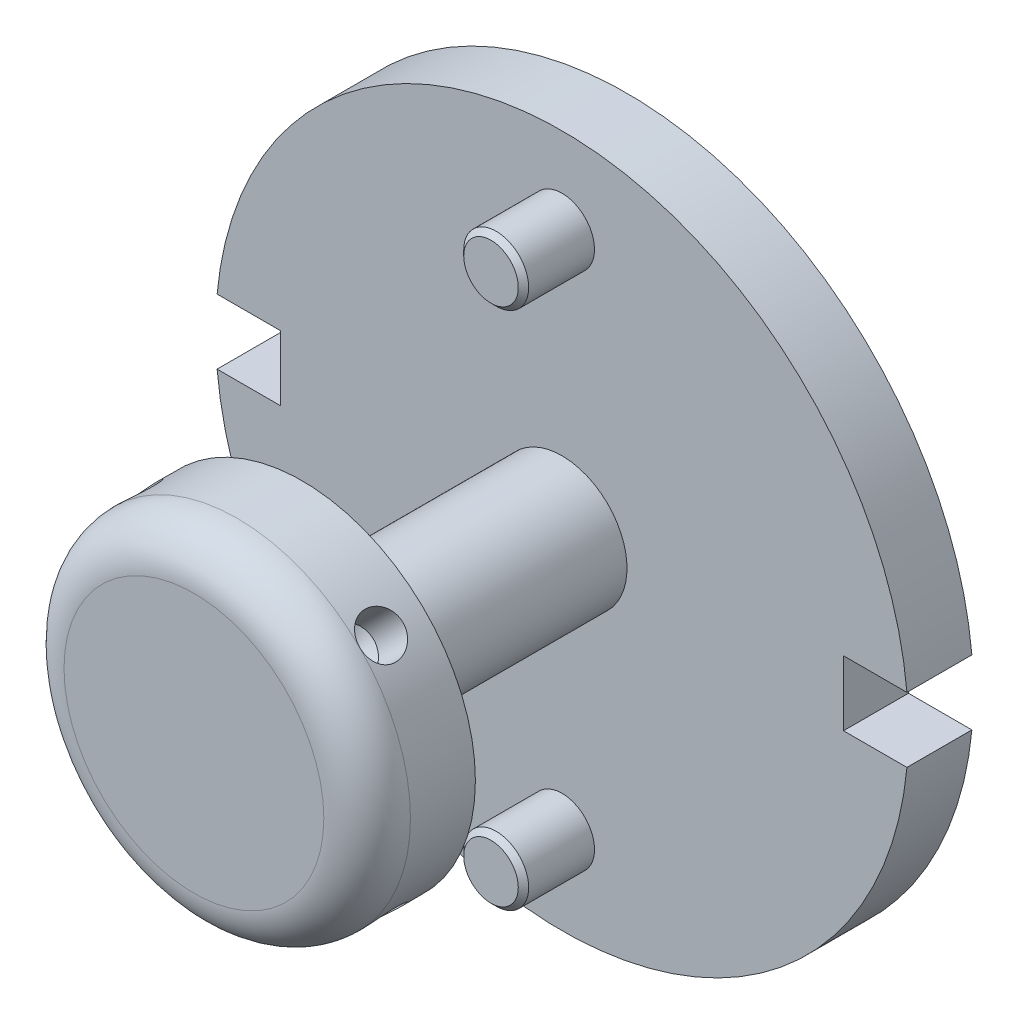
from build123d import *

# Parameters (mm, degrees)
BOSS_EXTRUDE1_DEPTH = 19.05
SKETCH2_R           = 9.525
BOSS_EXTRUDE2_DEPTH = 20.828
CHAMFER1_SIZE       = 1.524
SKETCH3_R           = 19.05
BOSS_EXTRUDE3_DEPTH = 76.2
SKETCH4_R           = 25.4
BOSS_EXTRUDE4_DEPTH = 19.05
BOSS_EXTRUDE5_START = 25.4
SKETCH5_R           = 19.05
BOSS_EXTRUDE5_DEPTH = 25.4
SKETCH7_R           = 50.8
BOSS_EXTRUDE6_DEPTH = 31.75
CIRPATTERN2_COUNT   = 4
FILLET2_R           = 12.7


with BuildPart() as part:
    # Sketch1 → Boss-Extrude1 (new body)
    with BuildSketch(Plane.XY):
        with BuildLine():
            Line((101.152530245, -9.525), (82.55, -9.525))
            Line((82.55, -9.525), (82.55, 9.525))
            Line((82.55, 9.525), (101.152530245, 9.525))
            ThreePointArc((101.152530245, 9.525), (0, 101.6), (-101.152530245, 9.525))
            Line((-101.152530245, 9.525), (-82.55, 9.525))
            Line((-82.55, 9.525), (-82.55, -9.525))
            Line((-82.55, -9.525), (-101.152530245, -9.525))
            ThreePointArc((-101.152530245, -9.525), (0, -101.6), (101.152530245, -9.525))
        make_face()
    extrude(amount=BOSS_EXTRUDE1_DEPTH)

    # Sketch2 → Boss-Extrude2 (add)
    with BuildSketch(Plane.XY.offset(19.05)):
        with Locations((0, -76.2)):
            Circle(SKETCH2_R)
        with Locations(Location((0, 76.2, 0), (0, 0, 180))):
            Circle(SKETCH2_R)
    extrude(amount=BOSS_EXTRUDE2_DEPTH)

    # Chamfer1
    chamfer1_edges = [part.edges().sort_by_distance(p)[0] for p in [
        (-9.525, -76.2, 39.878),
        (9.525, 76.2, 39.878),
    ]]
    chamfer(chamfer1_edges, length=CHAMFER1_SIZE)

    # Sketch3 → Boss-Extrude3 (add)
    with BuildSketch(Plane.XY.offset(19.05)):
        with Locations(Location((0, 0, 0), (0, 0, 180))):
            Circle(SKETCH3_R)
    extrude(amount=BOSS_EXTRUDE3_DEPTH)

    # Sketch4 → Boss-Extrude4 (add)
    with BuildSketch(Plane(origin=(0, 0, 0), x_dir=(-1, 0, 0), z_dir=(0, 0, -1))):
        Circle(SKETCH4_R)
    extrude(amount=BOSS_EXTRUDE4_DEPTH)

    # Sketch5 → Boss-Extrude5 (add)
    with BuildSketch(Plane(origin=(0, 0, -19.05), x_dir=(-1, 0, 0), z_dir=(0, 0, -1)).offset(BOSS_EXTRUDE5_START)):
        Circle(SKETCH5_R)
    extrude(amount=-BOSS_EXTRUDE5_DEPTH)

    # Sketch7 → Boss-Extrude6 (add)
    with BuildSketch(Plane.XY.offset(95.25)):
        Circle(SKETCH7_R)
    extrude(amount=BOSS_EXTRUDE6_DEPTH)

    # Sketch22 → #92 (0.5) Diameter Hole1 (revolve, cut)
    with BuildSketch(Plane(origin=(35.921024484, 35.921024484, 107.95), x_dir=(-0.7071067811865464, 0.7071067811865488, 0), z_dir=(0, 0, 1))):
        Polygon((0, 0), (0, 16.002), (6.35, 12.186535069), (6.35, 0), align=None)
    f_92_0_5_diameter_hole1 = revolve(axis=Axis((40.411152545, 40.411152545, 107.95), (-0.7071067811865487, -0.7071067811865465, 0)), mode=Mode.SUBTRACT)

    # CirPattern2: #92 (0.5) Diameter Hole1 ×4 about axis
    cirpattern2_axis = Axis((0, 0, 127), (0, 0, -1))
    for i in range(1, CIRPATTERN2_COUNT):
        add(f_92_0_5_diameter_hole1.rotate(cirpattern2_axis, i * 360 / CIRPATTERN2_COUNT), mode=Mode.SUBTRACT)

    # Fillet2
    fillet2_edges = [part.edges().sort_by_distance(p)[0] for p in [
        (-50.8, 0, 127),
    ]]
    fillet(fillet2_edges, radius=FILLET2_R - 0.0001)  # a hair under: the kernel refuses the full size


solid = part.part
